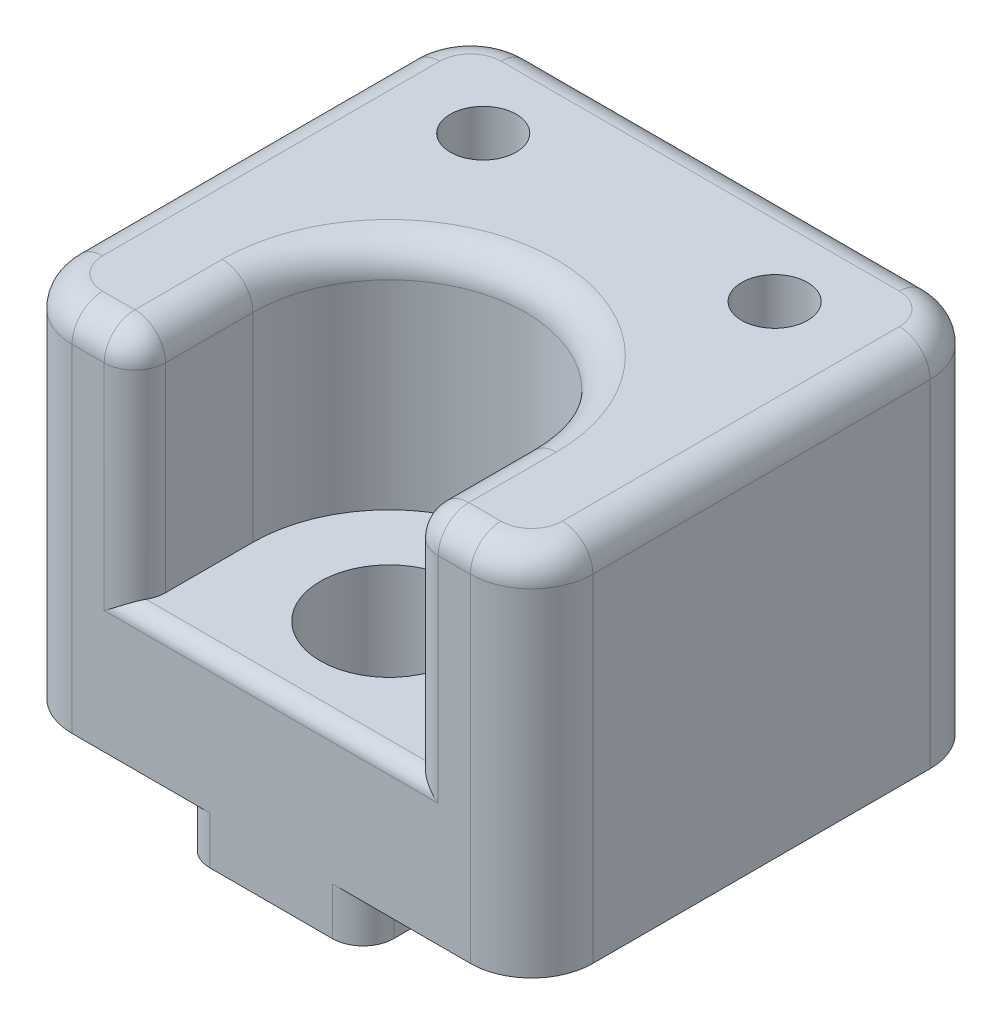
from build123d import *

# Parameters (mm, degrees)
SKETCH1_W                        = 17
SKETCH1_H                        = 15
BOSS_EXTRUDE1_DEPTH              = 13.55
SKETCH2_W                        = 5.5
SKETCH2_H                        = 1.55
CUT_EXTRUDE1_DEPTH               = 22.005951538
SKETCH3_W                        = 5.5
SKETCH3_H                        = 1.55
CUT_EXTRUDE2_DEPTH               = 22.005951538
CUT_EXTRUDE3_DEPTH               = 7.5
SKETCH5_W                        = 4.85
SKETCH5_H                        = 14
BOSS_EXTRUDE2_DEPTH              = 0.2
F_4_5_4_5_DIAMETER_HOLE1_D       = 4.5
F_2_15_2_15_DIAMETER_HOLE1_D     = 2.15
F_2_15_2_15_DIAMETER_HOLE1_DEPTH = 10
FILLET1_R                        = 2
FILLET2_R                        = 0.5
FILLET3_R                        = 1


with BuildPart() as part:
    # Sketch1 → Boss-Extrude1 (new body)
    with BuildSketch(Plane.XZ.offset(1.55)):
        Rectangle(SKETCH1_W, SKETCH1_H)
    extrude(amount=-BOSS_EXTRUDE1_DEPTH)

    # Sketch2 → Cut-Extrude1 (cut, through all)
    with BuildSketch(Plane(origin=(0, 0, -7.5), x_dir=(-1, 0, 0), z_dir=(0, 0, -1))):
        with Locations((-5.75, -0.775)):
            Rectangle(SKETCH2_W, SKETCH2_H)
    extrude(amount=-CUT_EXTRUDE1_DEPTH, mode=Mode.SUBTRACT)

    # Sketch3 → Cut-Extrude2 (cut, through all)
    with BuildSketch(Plane(origin=(0, 0, -7.5), x_dir=(-1, 0, 0), z_dir=(0, 0, -1))):
        with Locations((5.75, -0.775)):
            Rectangle(SKETCH3_W, SKETCH3_H)
    extrude(amount=-CUT_EXTRUDE2_DEPTH, mode=Mode.SUBTRACT)

    # Sketch4 → Cut-Extrude3 (cut)
    with BuildSketch(Plane(origin=(0, 12, 0), x_dir=(-1, 0, 0), z_dir=(0, 1, 0))):
        with BuildLine():
            Line((-4.45, 7.5), (-4.45, 3.65))
            ThreePointArc((-4.45, 3.65), (0, -0.8), (4.45, 3.65))
            Line((4.45, 3.65), (4.45, 7.5))
            Line((4.45, 7.5), (-4.45, 7.5))
        make_face()
    extrude(amount=-CUT_EXTRUDE3_DEPTH, mode=Mode.SUBTRACT)

    # Sketch5 → Boss-Extrude2 (add)
    with BuildSketch(Plane.XZ.offset(1.55)):
        with Locations((0.075, 0)):
            Rectangle(SKETCH5_W, SKETCH5_H)
    extrude(amount=BOSS_EXTRUDE2_DEPTH)

    # Ø4.5 (4.5) Diameter Hole1 (through all)
    with Locations(Plane(origin=(0, 4.5, 0), x_dir=(1, 0, 0), z_dir=(0, 1, 0))):
        with Locations((0, -3.65)):
            Hole(F_4_5_4_5_DIAMETER_HOLE1_D / 2)

    # Ø2.15 (2.15) Diameter Hole1
    with Locations(Plane(origin=(0, 12, 0), x_dir=(1, 0, 0), z_dir=(0, 1, 0))):
        with Locations((-4.755, 4.175), (4.755, 4.175)):
            Hole(F_2_15_2_15_DIAMETER_HOLE1_D / 2, depth=F_2_15_2_15_DIAMETER_HOLE1_DEPTH)

    # Fillet1
    fillet1_edges = [part.edges().sort_by_distance(p)[0] for p in [
        (-8.5, 6, -7.5),
        (8.5, 6, -7.5),
        (8.5, 6, 7.5),
        (-8.5, 6, 7.5),
    ]]
    fillet(fillet1_edges, radius=FILLET1_R)

    # Fillet2
    fillet2_edges = [part.edges().sort_by_distance(p)[0] for p in [
        (0, 4.5, 7.5),
        (2.5, -1.65, -7),
        (-2.35, -1.65, 7),
        (2.5, -1.65, 7),
        (-2.35, -1.65, -7),
    ]]
    fillet(fillet2_edges, radius=FILLET2_R)

    # Fillet3
    fillet3_edges = [part.edges().sort_by_distance(p)[0] for p in [
        (-3, -0.775, -7.5),
    ]]
    fillet(fillet3_edges, radius=FILLET3_R)
    fillet3_2_edges = [part.edges().sort_by_distance(p)[0] for p in [
        (-3, -0.775, 7.5),
    ]]
    fillet(fillet3_2_edges, radius=FILLET3_R)
    fillet3_3_edges = [part.edges().sort_by_distance(p)[0] for p in [
        (3, -0.775, 7.5),
    ]]
    fillet(fillet3_3_edges, radius=FILLET3_R)
    fillet3_4_edges = [part.edges().sort_by_distance(p)[0] for p in [
        (3, -0.775, -7.5),
    ]]
    fillet(fillet3_4_edges, radius=FILLET3_R)
    fillet3_5_edges = [part.edges().sort_by_distance(p)[0] for p in [
        (-4.45, 8, 7.5),
    ]]
    fillet(fillet3_5_edges, radius=FILLET3_R)
    fillet3_6_edges = [part.edges().sort_by_distance(p)[0] for p in [
        (4.45, 8, 7.5),
    ]]
    fillet(fillet3_6_edges, radius=FILLET3_R)
    fillet3_7_edges = [part.edges().sort_by_distance(p)[0] for p in [
        (0, 12, -0.8),
        (4.45, 12, 5.075),
        (-4.45, 12, 5.075),
    ]]
    fillet(fillet3_7_edges, radius=FILLET3_R)


solid = part.part
